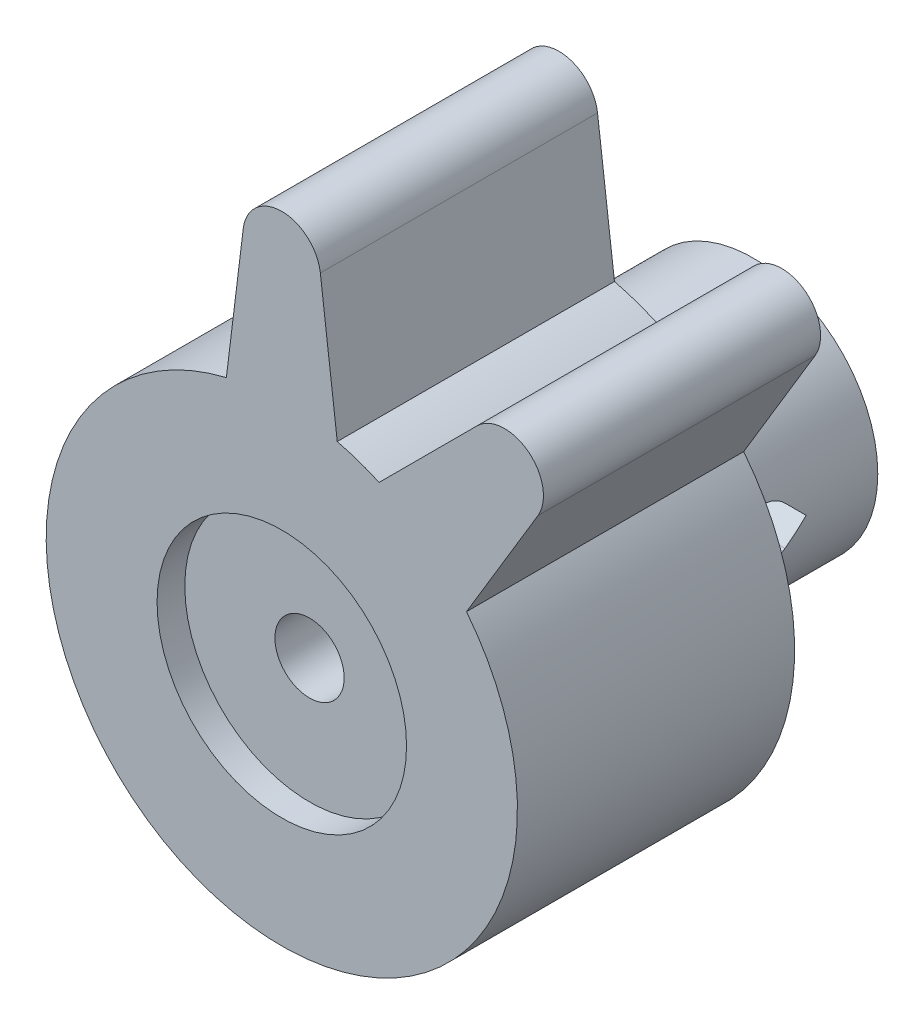
from build123d import *

# Parameters (mm, degrees)
SKETCH1_R               = 1.25
BOSS_EXTRUDE1_DEPTH     = 10
SKETCH5_R               = 4.5
SKETCH5_R_2             = 3
BOSS_EXTRUDE3_DEPTH     = 7
SKETCH8_R               = 4.5
CUT_EXTRUDE2_DEPTH      = 1
CUT_EXTRUDE3_DEPTH      = 20.949878445
CUT_EXTRUDE3_DEPTH_BACK = 20.949878445


with BuildPart() as part:
    # Sketch1 → Boss-Extrude1 (new body)
    with BuildSketch(Plane.XY):
        with BuildLine():
            Line((-1.390653283, 13.224086579), (-2, 8.261355821))
            ThreePointArc((-2, 8.261355821), (-2.767329313, -8.036907893), (6.66222002, 5.278714276))
            Line((6.66222002, 5.278714276), (9.237410395, 9.564550779))
            ThreePointArc((9.237410395, 9.564550779), (8.899037344, 11.390248383), (7.045710912, 11.276894083))
            Line((7.045710912, 11.276894083), (3.510177006, 7.741360177))
            ThreePointArc((3.510177006, 7.741360177), (2.767329313, 8.036907893), (2, 8.261355821))
            Line((2, 8.261355821), (1.390653283, 13.224086579))
            ThreePointArc((1.390653283, 13.224086579), (0, 14.454432673), (-1.390653283, 13.224086579))
        make_face()
        Circle(SKETCH1_R, mode=Mode.SUBTRACT)
    extrude(amount=BOSS_EXTRUDE1_DEPTH)

    # Sketch5 → Boss-Extrude3 (add)
    with BuildSketch(Plane(origin=(0, 0, 0), x_dir=(-1, 0, 0), z_dir=(0, 0, -1))):
        Circle(SKETCH5_R)
        Circle(SKETCH5_R_2, mode=Mode.SUBTRACT)
    extrude(amount=BOSS_EXTRUDE3_DEPTH)

    # Sketch8 → Cut-Extrude2 (cut)
    with BuildSketch(Plane.XY.offset(10)):
        Circle(SKETCH8_R)
    extrude(amount=-CUT_EXTRUDE2_DEPTH, mode=Mode.SUBTRACT)

    # Sketch6 → Cut-Extrude3 (cut, two sides: drawn at the far end of the back side and taken through both)
    with BuildSketch(Plane(origin=(0, 0, 0), x_dir=(0, 0, -1), z_dir=(1, 0, 0)).offset(-CUT_EXTRUDE3_DEPTH_BACK)):
        with BuildLine():
            Line((4.414213562, 0), (3.707106781, 0.707106781))
            ThreePointArc((3.707106781, 0.707106781), (2, 0), (3.707106781, -0.707106781))
            Line((3.707106781, -0.707106781), (4.414213562, 0))
        make_face()
    extrude(amount=CUT_EXTRUDE3_DEPTH + CUT_EXTRUDE3_DEPTH_BACK, mode=Mode.SUBTRACT)


solid = part.part
